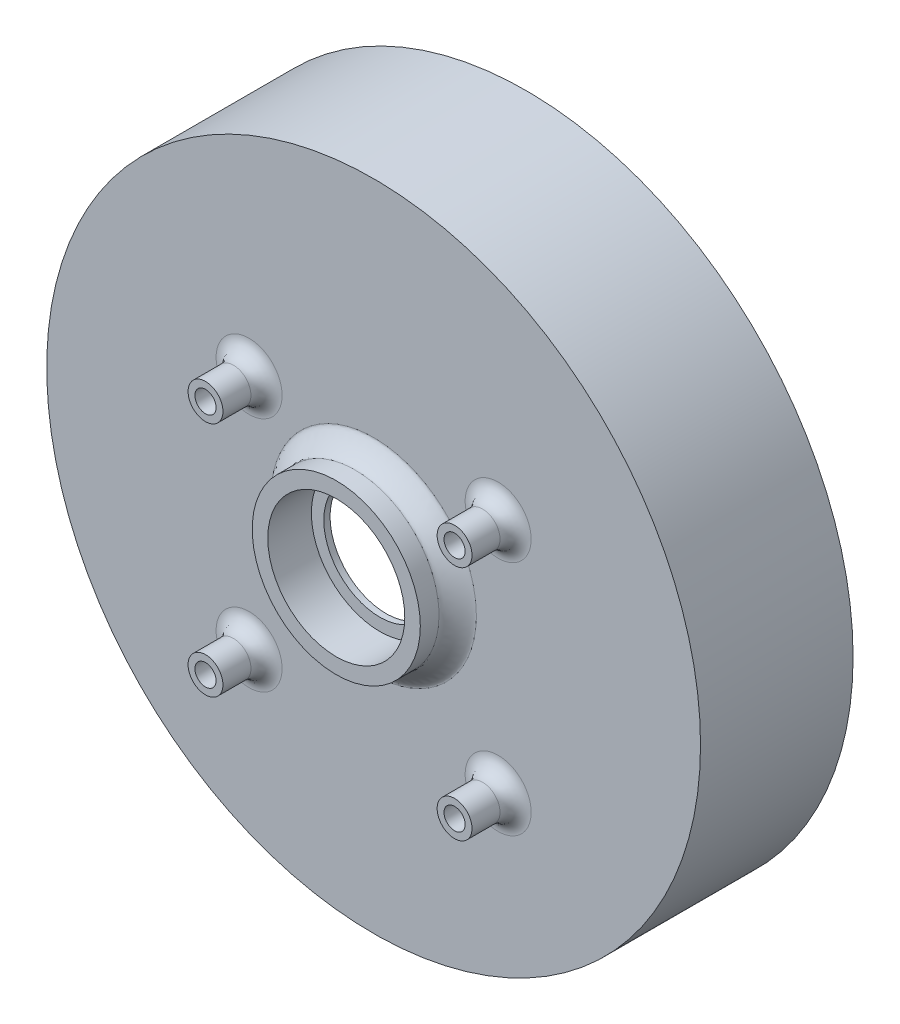
from build123d import *

# Parameters (mm, degrees)
SKETCH1_R           = 52.5
SKETCH1_R_2         = 45
BOSS_EXTRUDE1_DEPTH = 22.5
BOSS_EXTRUDE2_START = 22.5
SKETCH1_2_R         = 52.5
SKETCH1_2_R_2       = 11
BOSS_EXTRUDE2_DEPTH = 2
SKETCH3_R           = 2.8
SKETCH3_R_2         = 1.7
BOSS_EXTRUDE3_DEPTH = 7
FILLET1_R           = 2.5
SKETCH4_R           = 13.5
SKETCH4_R_2         = 11
BOSS_EXTRUDE4_DEPTH = 6
SKETCH5_R           = 11
SKETCH5_R_2         = 9
BOSS_EXTRUDE5_DEPTH = 1
SKETCH7_R           = 2.15
CUT_EXTRUDE1_DEPTH  = 10
CUT_EXTRUDE3_START  = -40
CUT_EXTRUDE3_DEPTH  = 20
FILLET2_SIZE        = 3


with BuildPart() as part:
    # Sketch1 → Boss-Extrude1 (new body)
    with BuildSketch(Plane.XY):
        with Locations(Location((0, 0, 0), (0, 0, 180))):
            Circle(SKETCH1_R)
        with Locations(Location((0, 0, 0), (0, 0, 180))):
            Circle(SKETCH1_R_2, mode=Mode.SUBTRACT)
    extrude(amount=BOSS_EXTRUDE1_DEPTH)

    # Sketch1<2> → Boss-Extrude2 (add)
    with BuildSketch(Plane.XY.offset(BOSS_EXTRUDE2_START)):
        with Locations(Location((0, 0, 0), (0, 0, 180))):
            Circle(SKETCH1_2_R)
        Circle(SKETCH1_2_R_2, mode=Mode.SUBTRACT)
    extrude(amount=BOSS_EXTRUDE2_DEPTH)

    # Sketch3 → Boss-Extrude3 (add)
    # profile 1 of 4: a face of its own
    with BuildSketch(Plane.XY.offset(24.5)):
        with Locations((-20, 15)):
            Circle(SKETCH3_R)
        with Locations((-20, 15)):
            Circle(SKETCH3_R_2, mode=Mode.SUBTRACT)
    # profile 2 of 4: a face of its own
    with BuildSketch(Plane.XY.offset(24.5)):
        with Locations((20, 15)):
            Circle(SKETCH3_R)
        with Locations((20, 15)):
            Circle(SKETCH3_R_2, mode=Mode.SUBTRACT)
    # profile 3 of 4: a face of its own
    with BuildSketch(Plane.XY.offset(24.5)):
        with Locations((20, -23)):
            Circle(SKETCH3_R)
        with Locations((20, -23)):
            Circle(SKETCH3_R_2, mode=Mode.SUBTRACT)
    # profile 4 of 4: a face of its own
    with BuildSketch(Plane.XY.offset(24.5)):
        with Locations((-20, -23)):
            Circle(SKETCH3_R)
        with Locations((-20, -23)):
            Circle(SKETCH3_R_2, mode=Mode.SUBTRACT)
    extrude(amount=BOSS_EXTRUDE3_DEPTH)

    # Fillet1
    fillet1_edges = [part.edges().sort_by_distance(p)[0] for p in [
        (-22.8, 15, 24.5),
        (17.2, 15, 24.5),
        (17.2, -23, 24.5),
        (-22.8, -23, 24.5),
    ]]
    fillet(fillet1_edges, radius=FILLET1_R)

    # Sketch4 → Boss-Extrude4 (add)
    with BuildSketch(Plane.XY.offset(24.5)):
        Circle(SKETCH4_R)
        Circle(SKETCH4_R_2, mode=Mode.SUBTRACT)
    extrude(amount=BOSS_EXTRUDE4_DEPTH)

    # Sketch5 → Boss-Extrude5 (add)
    with BuildSketch(Plane(origin=(0, 0, 22.5), x_dir=(-1, 0, 0), z_dir=(0, 0, -1))):
        Circle(SKETCH5_R)
        Circle(SKETCH5_R_2, mode=Mode.SUBTRACT)
    extrude(amount=-BOSS_EXTRUDE5_DEPTH)

    # Sketch7 → Cut-Extrude1 (cut)
    with BuildSketch(Plane(origin=(0, 0, 0), x_dir=(-1, 0, 0), z_dir=(0, 0, -1))):
        with Locations((-34.471455583, 34.471455583)):
            Circle(SKETCH7_R)
        with Locations((34.471455583, 34.471455583)):
            Circle(SKETCH7_R)
        with Locations((34.471455583, -34.471455583)):
            Circle(SKETCH7_R)
        with Locations((-34.471455583, -34.471455583)):
            Circle(SKETCH7_R)
    extrude(amount=-CUT_EXTRUDE1_DEPTH, mode=Mode.SUBTRACT)

    # Sketch8 → Cut-Extrude3 (cut)
    with BuildSketch(Plane(origin=(0, 0, 0), x_dir=(1, 0, 0), z_dir=(0, 1, 0)).offset(CUT_EXTRUDE3_START)):
        with BuildLine():
            Line((0, -13.134452127), (2.84951796, -8.198942243))
            ThreePointArc((2.84951796, -8.198942243), (-0.060853845, -3.193473944), (-2.909727738, -8.234197551))
            Line((-2.909727738, -8.234197551), (0, -13.134452127))
        make_face()
    extrude(amount=-CUT_EXTRUDE3_DEPTH, mode=Mode.SUBTRACT)

    # Fillet2
    # a fillet whose section is not a circle: 3 mm, written as the material it adds along each edge
    with BuildSketch(Plane(origin=(0, 0, 24.5), x_dir=(1, 0, 0), z_dir=(0, -1, 0))) as fillet2_piece_1:
        with BuildLine():
            Bezier((13.5 + FILLET2_SIZE, 0), (13.5, 0), (13.5, FILLET2_SIZE), weights=[1, 0.212132034, 1])
            Line((13.5, FILLET2_SIZE), (13.5, 0))
            Line((13.5, 0), (13.5 + FILLET2_SIZE, 0))
        make_face()
    revolve(axis=Axis((0, 0, 24.5), (0, 0, 1)))


solid = part.part
